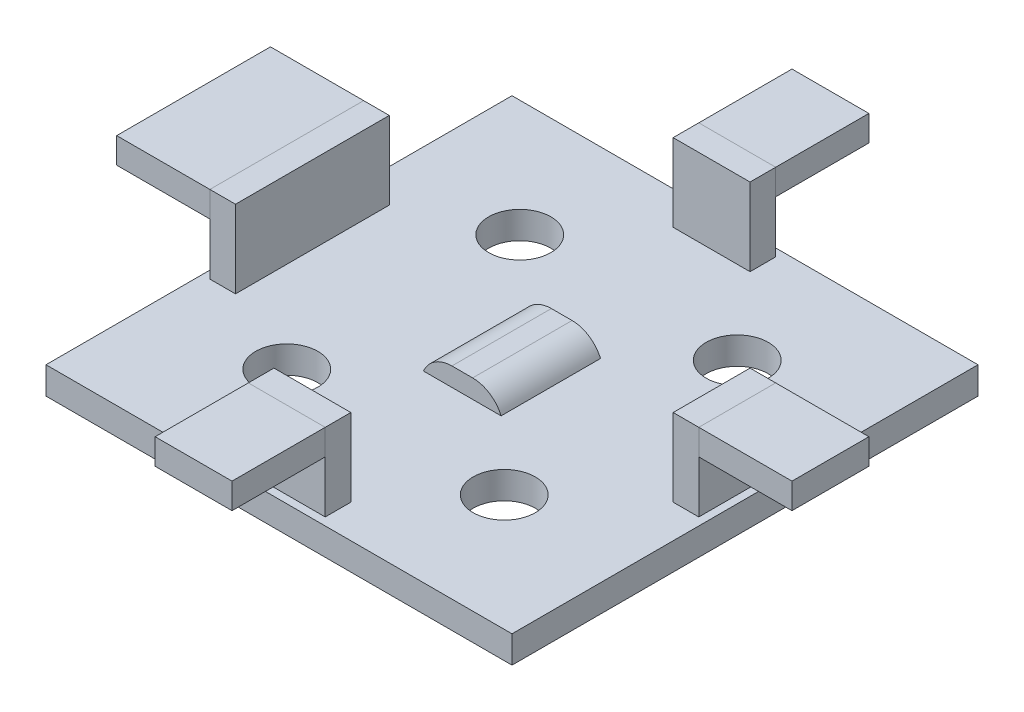
from build123d import *

# Parameters (mm, degrees)
SKETCH1_W           = 30
SKETCH1_H           = 30
BOSS_EXTRUDE1_DEPTH = 1.75
SKETCH2_R           = 2
CUT_EXTRUDE1_DEPTH  = 1.75
SKETCH3_W           = 5
SKETCH3_H           = 6.4
BOSS_EXTRUDE2_DEPTH = 1.2
FILLET1_R           = 2
SKETCH4_W           = 1.65
SKETCH4_H           = 4.95
SKETCH4_H_2         = 9.9
SKETCH4_W_2         = 4.95
SKETCH4_H_3         = 1.65
BOSS_EXTRUDE3_DEPTH = 5
SKETCH5_W           = 4.95
SKETCH5_H           = 1.65
BASE_FLANGE1_DEPTH  = 6
SKETCH10_W          = 4.95
SKETCH10_H          = 1.65
BASE_FLANGE2_DEPTH  = 6
SKETCH13_W          = 4.95
SKETCH13_H          = 1.65
BASE_FLANGE3_DEPTH  = 6
SKETCH16_W          = 9.9
SKETCH16_H          = 1.65
BASE_FLANGE4_DEPTH  = 6


# Sheet-metal steps are written as plain solids
with BuildPart() as part:
    # Sketch1 → Boss-Extrude1 (new body)
    with BuildSketch(Plane(origin=(0, 0, 0), x_dir=(1, 0, 0), z_dir=(0, 1, 0))):
        with Locations((15, 15)):
            Rectangle(SKETCH1_W, SKETCH1_H)
    extrude(amount=BOSS_EXTRUDE1_DEPTH)

    # Sketch2 → Cut-Extrude1 (cut)
    with BuildSketch(Plane(origin=(0, 1.75, 0), x_dir=(1, 0, 0), z_dir=(0, 1, 0))):
        with Locations(Location((22, 22.5, 0), (0, 0, 270))):
            Circle(SKETCH2_R)
        with Locations(Location((22, 7.5, 0), (0, 0, 90))):
            Circle(SKETCH2_R)
        with Locations(Location((8, 22.5, 0), (0, 0, 90))):
            Circle(SKETCH2_R)
        with Locations(Location((8, 7.5, 0), (0, 0, 270))):
            Circle(SKETCH2_R)
    extrude(amount=-CUT_EXTRUDE1_DEPTH, mode=Mode.SUBTRACT)

    # Sketch3 → Boss-Extrude2 (add)
    with BuildSketch(Plane(origin=(0, 1.75, 0), x_dir=(1, 0, 0), z_dir=(0, 1, 0))):
        with Locations((15, 15)):
            Rectangle(SKETCH3_W, SKETCH3_H)
    extrude(amount=BOSS_EXTRUDE2_DEPTH)

    # Fillet1
    # the kernel refuses this fillet: 2 mm, written as the material it takes off along each edge
    with BuildSketch(Plane(origin=(17.5, 2.95, -22.782575695), x_dir=(0, -1, 0), z_dir=(0, 0, 1)), Plane(origin=(12.5, 2.95, -7.217424305), x_dir=(0, -1, 0), z_dir=(0, 0, -1))) as fillet1_piece_1:
        with BuildLine():
            CenterArc((2, -1.833030278), FILLET1_R, 113.578178478, 66.421821522)
            Line((0, -1.833030278), (-0.04, -1.833030278))
            Line((-0.04, -1.833030278), (-0.04, 0))
            Line((-0.04, 0), (0, 0.04))
            ThreePointArc((0, 0.04), (0.6, 0.04), (1.184, 0.036660606))
            Line((1.184, 0.036660606), (1.2, 0))
        make_face()
    extrude(amount=15.56515139, mode=Mode.SUBTRACT)

    # Sketch4 → Boss-Extrude3 (add)
    with BuildSketch(Plane(origin=(0, 1.75, 0), x_dir=(1, 0, 0), z_dir=(0, 1, 0))):
        with Locations((28.675, 15)):
            Rectangle(SKETCH4_W, SKETCH4_H)
        with Locations((1.325, 15)):
            Rectangle(SKETCH4_W, SKETCH4_H_2)
        with Locations((15, 1.325)):
            Rectangle(SKETCH4_W_2, SKETCH4_H_3)
        with Locations((15, 28.675)):
            Rectangle(SKETCH4_W_2, SKETCH4_H_3)
    extrude(amount=BOSS_EXTRUDE3_DEPTH)


with BuildPart() as body_2:
    # Sketch5 → Base-Flange1 (new body)
    with BuildSketch(Plane.XY.offset(-0.5)):
        with Locations((15, 5.925)):
            Rectangle(SKETCH5_W, SKETCH5_H)
    extrude(amount=BASE_FLANGE1_DEPTH)


with BuildPart() as body_3:
    # Sketch10 → Base-Flange2 (new body)
    with BuildSketch(Plane(origin=(29.5, 0, 0), x_dir=(0, 0, -1), z_dir=(1, 0, 0))):
        with Locations((15, 5.925)):
            Rectangle(SKETCH10_W, SKETCH10_H)
    extrude(amount=BASE_FLANGE2_DEPTH)


with BuildPart() as body_4:
    # Sketch13 → Base-Flange3 (new body)
    with BuildSketch(Plane(origin=(0, 0, -29.5), x_dir=(-1, 0, 0), z_dir=(0, 0, -1))):
        with Locations((-15, 5.925)):
            Rectangle(SKETCH13_W, SKETCH13_H)
    extrude(amount=BASE_FLANGE3_DEPTH)


with BuildPart() as body_5:
    # Sketch16 → Base-Flange4 (new body)
    with BuildSketch(Plane.ZY.offset(-0.5)):
        with Locations((-15, 5.925)):
            Rectangle(SKETCH16_W, SKETCH16_H)
    extrude(amount=BASE_FLANGE4_DEPTH)


solid = Compound([part.part, body_2.part, body_3.part, body_4.part, body_5.part])
